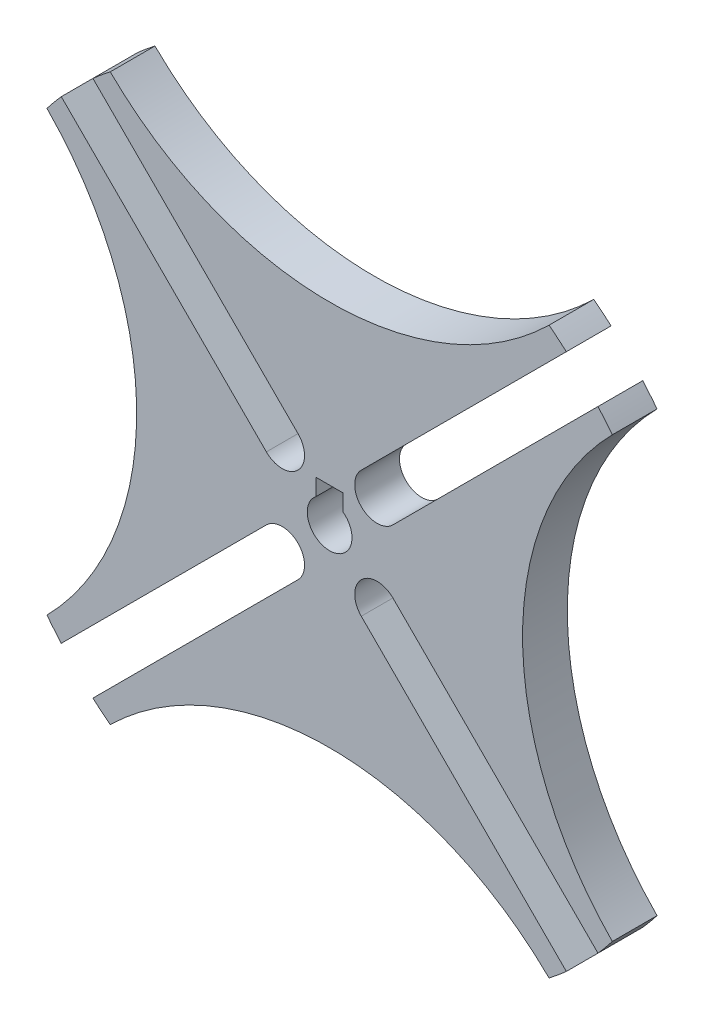
from build123d import *

# Parameters (mm, degrees)
EXTRUDE_1_OUTLINE_R = 0.19875
EXTRUDE_1_DEPTH     = 0.3975
SCALE_3_SCALE       = 25
SKETCH_2_W          = 6
SKETCH_2_H          = 7.65
CUT_EXTRUDE_1_DEPTH = 10


# Read off the part's stored shape, not the designer's step: 凸台-拉伸1
with BuildPart() as part:
    # 凸台-拉伸1 outline → 凸台-拉伸1 (new body)
    with BuildSketch(Plane.XY):
        with BuildLine():
            Line((0.281074946, 0.562149891), (2.103665998, 2.384740944))
            ThreePointArc((2.103665998, 2.384740944), (2.027732849, 2.449632522), (1.949799165, 2.512107326))
            ThreePointArc((1.949799165, 2.512107326), (0, 1.714699128), (-1.949799165, 2.512107326))
            ThreePointArc((-1.949799165, 2.512107326), (-2.027732849, 2.449632522), (-2.103665998, 2.384740944))
            Line((-2.103665998, 2.384740944), (-0.281074946, 0.562149891))
            ThreePointArc((-0.281074946, 0.562149891), (-0.281074946, 0.281074946), (-0.562149891, 0.281074946))
            Line((-0.562149891, 0.281074946), (-2.384740944, 2.103665998))
            ThreePointArc((-2.384740944, 2.103665998), (-2.449632522, 2.027732849), (-2.512107326, 1.949799165))
            ThreePointArc((-2.512107326, 1.949799165), (-1.714699128, 0), (-2.512107326, -1.949799165))
            ThreePointArc((-2.512107326, -1.949799165), (-2.449632522, -2.027732849), (-2.384740944, -2.103665998))
            Line((-2.384740944, -2.103665998), (-0.562149891, -0.281074946))
            ThreePointArc((-0.562149891, -0.281074946), (-0.281074946, -0.281074946), (-0.281074946, -0.562149891))
            Line((-0.281074946, -0.562149891), (-2.103665998, -2.384740944))
            ThreePointArc((-2.103665998, -2.384740944), (-2.027732849, -2.449632522), (-1.949799165, -2.512107326))
            ThreePointArc((-1.949799165, -2.512107326), (0, -1.714699128), (1.949799165, -2.512107326))
            ThreePointArc((1.949799165, -2.512107326), (2.027732849, -2.449632522), (2.103665998, -2.384740944))
            Line((2.103665998, -2.384740944), (0.281074946, -0.562149891))
            ThreePointArc((0.281074946, -0.562149891), (0.281074946, -0.281074946), (0.562149891, -0.281074946))
            Line((0.562149891, -0.281074946), (2.384740944, -2.103665998))
            ThreePointArc((2.384740944, -2.103665998), (2.449632522, -2.027732849), (2.512107326, -1.949799165))
            ThreePointArc((2.512107326, -1.949799165), (1.714699128, 0), (2.512107326, 1.949799165))
            ThreePointArc((2.512107326, 1.949799165), (2.449632522, 2.027732849), (2.384740944, 2.103665998))
            Line((2.384740944, 2.103665998), (0.562149891, 0.281074946))
            ThreePointArc((0.562149891, 0.281074946), (0.281074946, 0.281074946), (0.281074946, 0.562149891))
        make_face()
        Circle(EXTRUDE_1_OUTLINE_R, mode=Mode.SUBTRACT)
    extrude(amount=EXTRUDE_1_DEPTH)


with BuildPart() as part_1:
    # 缩放比例3: scaled about (0, 0, 0.19875)
    add(part.part.scale(SCALE_3_SCALE).moved(Location((0, 0, -4.77))))

    # 草图2 → 切除-拉伸1 (cut)
    with BuildSketch(Plane.XY.offset(5.1675)):
        with Locations((0, 3.825)):
            Rectangle(SKETCH_2_W, SKETCH_2_H)
    extrude(amount=-CUT_EXTRUDE_1_DEPTH, mode=Mode.SUBTRACT)


solid = part_1.part
